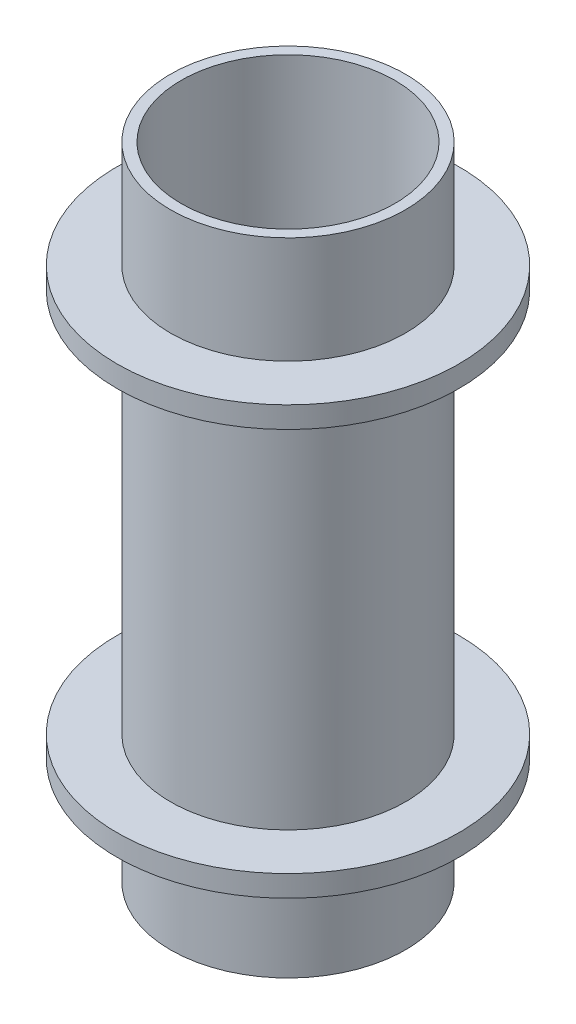
from build123d import *

# Parameters (mm, degrees)
SKETCH_1_R      = 11
SKETCH_1_R_2    = 10
EXTRUDE_1_DEPTH = 60
EXTRUDE_START   = -12
SKETCH_2_R      = 16
SKETCH_2_R_2    = 11
EXTRUDE_3_DEPTH = 2
EXTRUDE_START_2 = -10
SKETCH_3_R      = 16
SKETCH_3_R_2    = 11
EXTRUDE_4_DEPTH = 2


with BuildPart() as part:
    # Эскиз1 → Бобышка-Вытянуть1 (new body)
    with BuildSketch(Plane(origin=(0, 0, 0), x_dir=(1, 0, 0), z_dir=(0, 1, 0))):
        Circle(SKETCH_1_R)
        Circle(SKETCH_1_R_2, mode=Mode.SUBTRACT)
    extrude(amount=EXTRUDE_1_DEPTH)

    # Эскиз2 → Бобышка-Вытянуть3 (add)
    with BuildSketch(Plane(origin=(0, 60, 0), x_dir=(1, 0, 0), z_dir=(0, 1, 0)).offset(EXTRUDE_START)):
        Circle(SKETCH_2_R)
        Circle(SKETCH_2_R_2, mode=Mode.SUBTRACT)
    extrude(amount=EXTRUDE_3_DEPTH)

    # Эскиз3 → Бобышка-Вытянуть4 (add)
    with BuildSketch(Plane.XZ.offset(EXTRUDE_START_2)):
        Circle(SKETCH_3_R)
        Circle(SKETCH_3_R_2, mode=Mode.SUBTRACT)
    extrude(amount=-EXTRUDE_4_DEPTH)


solid = part.part
